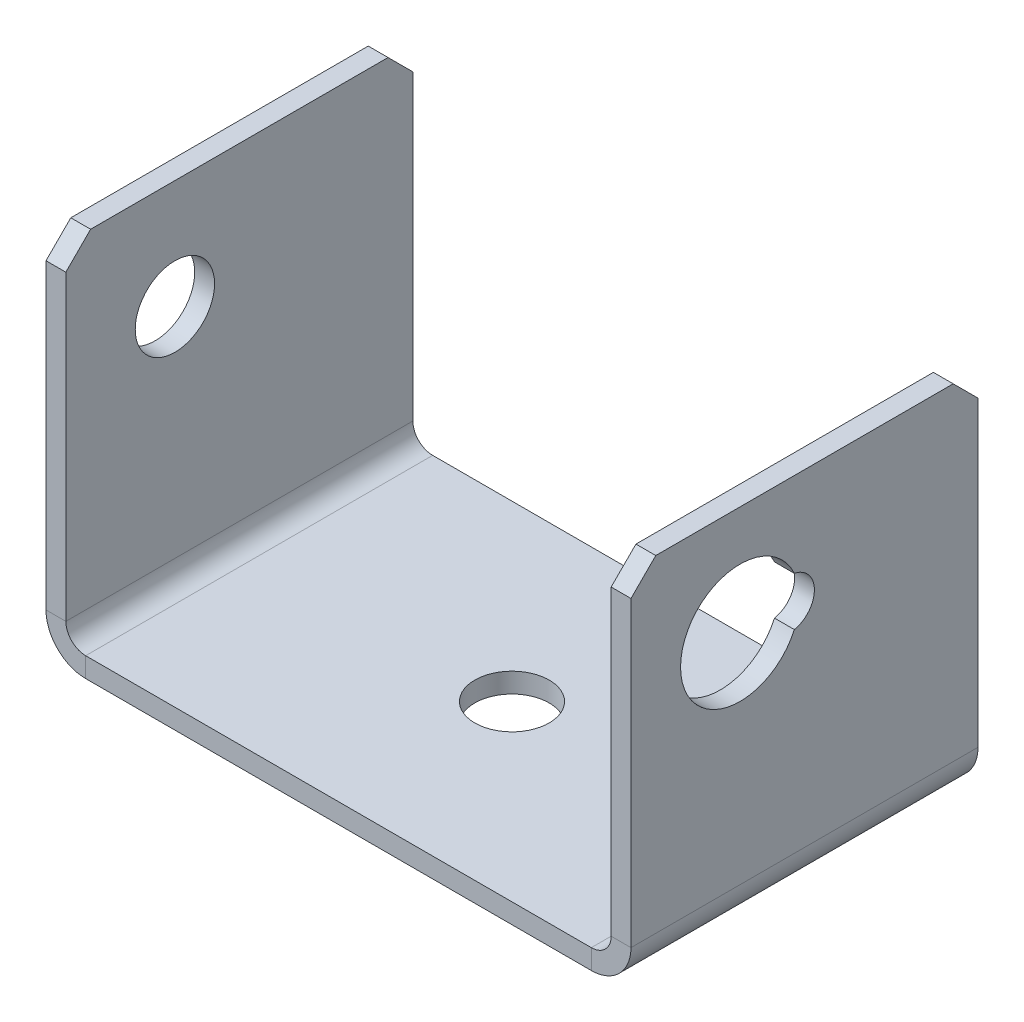
from build123d import *

# Parameters (mm, degrees)
BASE_FLANGE1_DEPTH = 35
CUT_EXTRUDE1_REACH = 79.942
CUT_EXTRUDE2_REACH = 79.942
SKETCH7_R          = 4
CUT_EXTRUDE3_REACH = 77.492
SKETCH8_R          = 3.75
CHAMFER1_SIZE      = 2.5


# Sheet-metal steps are written as plain solids
with BuildPart() as part:
    # Sketch1 → Base-Flange1 (new body)
    with BuildSketch(Plane.XY):
        with BuildLine():
            Line((0, 0), (0, -33))
            ThreePointArc((0, -33), (0.585786438, -34.414213562), (2, -35))
            Line((2, -35), (53, -35))
            ThreePointArc((53, -35), (54.414213562, -34.414213562), (55, -33))
            Line((55, -33), (55, 0))
            Line((55, 0), (57, 0))
            Line((57, 0), (57, -33))
            ThreePointArc((57, -33), (55.828427125, -35.828427125), (53, -37))
            Line((53, -37), (2, -37))
            ThreePointArc((2, -37), (-0.828427125, -35.828427125), (-2, -33))
            Line((-2, -33), (-2, 0))
            Line((-2, 0), (0, 0))
        make_face()
    extrude(amount=BASE_FLANGE1_DEPTH)

    # Sketch6 → Cut-Extrude1 (cut, up to next)
    with BuildSketch(Plane(origin=(57, 0, 0), x_dir=(0, 0, -1), z_dir=(1, 0, 0)), mode=Mode.PRIVATE) as cut_extrude1_sk1:
        with BuildLine():
            ThreePointArc((-18.525, -8.545539774), (-30, -11), (-18.525, -13.454460226))
            ThreePointArc((-18.525, -13.454460226), (-16.5, -11), (-18.525, -8.545539774))
        make_face()
    cut_extrude1_tool1 = extrude(cut_extrude1_sk1.sketch, amount=-CUT_EXTRUDE1_REACH, mode=Mode.PRIVATE) & part.part
    add(cut_extrude1_tool1.solids().sort_by_distance((57, -11, 23.686214))[0], mode=Mode.SUBTRACT)

    # Sketch7 → Cut-Extrude2 (cut, up to next)
    with BuildSketch(Plane.ZY.offset(2), mode=Mode.PRIVATE) as cut_extrude2_sk1:
        with Locations((24, -11)):
            Circle(SKETCH7_R)
    cut_extrude2_tool1 = extrude(cut_extrude2_sk1.sketch, amount=-CUT_EXTRUDE2_REACH, mode=Mode.PRIVATE) & part.part
    add(cut_extrude2_tool1.solids().sort_by_distance((-2, -11, 24))[0], mode=Mode.SUBTRACT)

    # Sketch8 → Cut-Extrude3 (cut, up to next)
    with BuildSketch(Plane(origin=(0, -35, 0), x_dir=(1, 0, 0), z_dir=(0, 1, 0)), mode=Mode.PRIVATE) as cut_extrude3_sk1:
        with Locations(Location((27.5, -17.5, 0), (0, 0, 270))):
            Circle(SKETCH8_R)
    cut_extrude3_tool1 = extrude(cut_extrude3_sk1.sketch, amount=-CUT_EXTRUDE3_REACH, mode=Mode.PRIVATE) & part.part
    add(cut_extrude3_tool1.solids().sort_by_distance((27.5, -35, 17.5))[0], mode=Mode.SUBTRACT)

    # Chamfer1
    chamfer1_edges = [part.edges().sort_by_distance(p)[0] for p in [
        (-1, 0, 0),
        (56, 0, 0),
        (-1, 0, 35),
        (56, 0, 35),
    ]]
    chamfer(chamfer1_edges, length=CHAMFER1_SIZE)


solid = part.part
